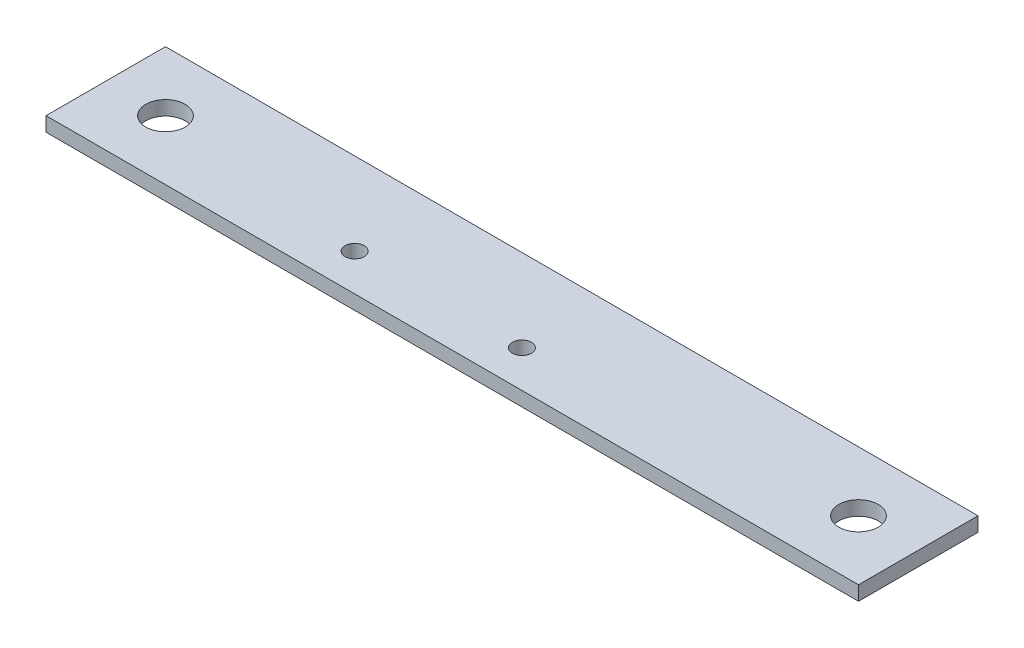
from build123d import *

# Parameters (mm, degrees)
SKETCH1_W           = 170
SKETCH1_H           = 25
SKETCH1_R           = 2
SKETCH1_R_2         = 4.125
BOSS_EXTRUDE1_DEPTH = 3
SKETCH2_R           = 4.125
CUT_EXTRUDE1_DEPTH  = 86.966563267


with BuildPart() as part:
    # Sketch1 → Boss-Extrude1 (new body)
    with BuildSketch(Plane(origin=(0, 0, 0), x_dir=(1, 0, 0), z_dir=(0, 1, 0))):
        Rectangle(SKETCH1_W, SKETCH1_H)
        with Locations((-28.158485727, -4.763382536)):
            Circle(SKETCH1_R, mode=Mode.SUBTRACT)
        with Locations((6.841514273, -4.763382536)):
            Circle(SKETCH1_R, mode=Mode.SUBTRACT)
        with Locations((72.5, 0)):
            Circle(SKETCH1_R_2, mode=Mode.SUBTRACT)
    extrude(amount=BOSS_EXTRUDE1_DEPTH)

    # Sketch2 → Cut-Extrude1 (cut, through all)
    with BuildSketch(Plane(origin=(0, 3, 0), x_dir=(1, 0, 0), z_dir=(0, 1, 0))):
        with Locations((-72.5, 0)):
            Circle(SKETCH2_R)
    extrude(amount=-CUT_EXTRUDE1_DEPTH, mode=Mode.SUBTRACT)


solid = part.part
